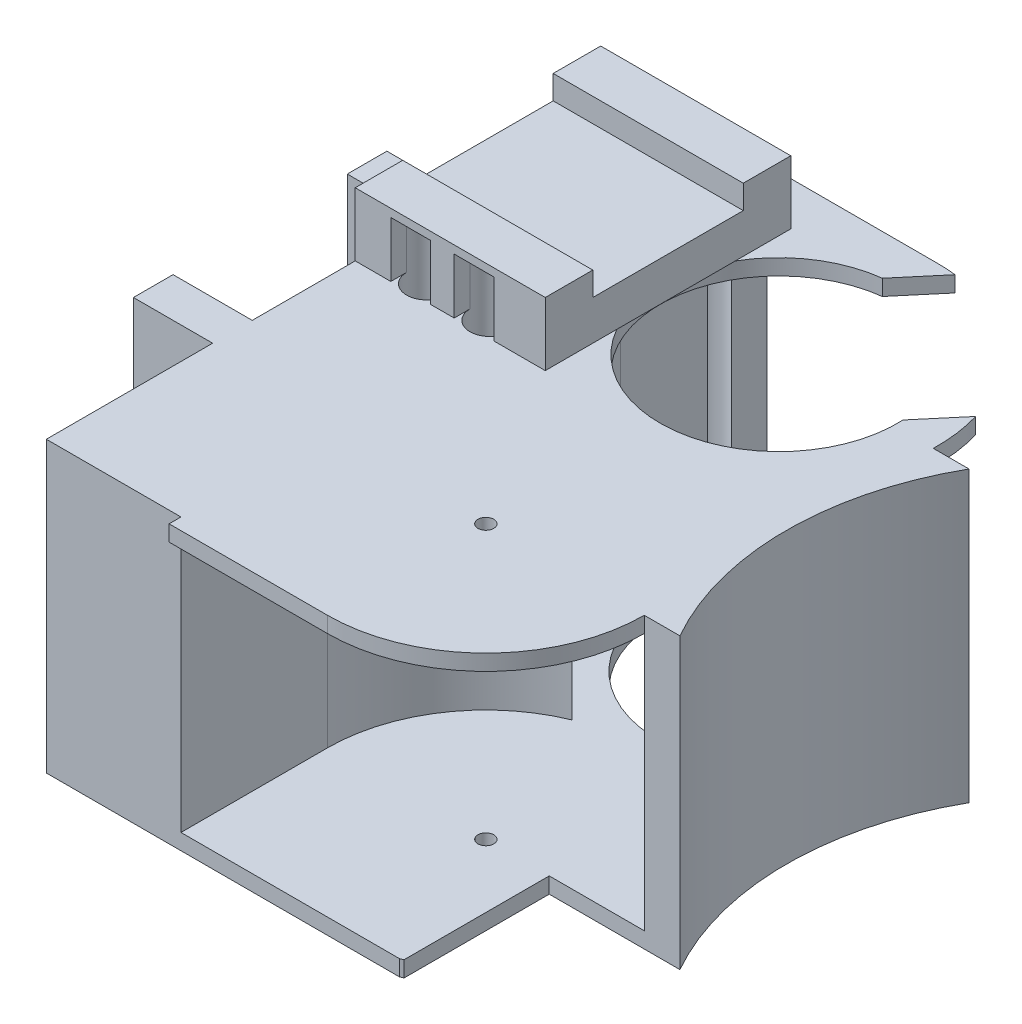
from build123d import *
from build123d.topology import SkipClean

# Parameters (mm, degrees)
SKETCH1_R                = 2.5
SKETCH1_R_2              = 1
SKETCH1_R_3              = 2
BOSS_EXTRUDE18_DEPTH     = 34.5
CUT_EXTRUDE16_START      = -32.5
CUT_EXTRUDE16_DEPTH      = 32.5
BOSS_EXTRUDE21_START     = -2
BOSS_EXTRUDE21_DEPTH     = 2
BOSS_EXTRUDE22_START     = -34.5
SKETCH9_R                = 2
BOSS_EXTRUDE22_DEPTH     = 34.5
BOSS_EXTRUDE23_START     = -34.5
SKETCH10_R               = 2
BOSS_EXTRUDE23_DEPTH     = 34.5
SKETCH11_R               = 2
CUT_EXTRUDE17_DEPTH      = 34.5
SKETCH12_W               = 24
SKETCH12_H               = 27
BOSS_EXTRUDE24_DEPTH     = 8
SKETCH13_W               = 24
SKETCH13_H               = 19
CUT_EXTRUDE18_DEPTH      = 3
SKETCH16_R               = 2.5
CUT_EXTRUDE21_DEPTH      = 41.5
SKETCH20_R               = 2.5
CUT_EXTRUDE22_DEPTH      = 41.5
SKETCH21_R               = 2.5
CUT_EXTRUDE23_DEPTH      = 41.5
SKETCH22_R               = 2.5
CUT_EXTRUDE24_DEPTH      = 41.5
BOSS_EXTRUDE25_DEPTH     = 2
BOSS_EXTRUDE26_DEPTH     = 2
SKETCH27_R               = 1
CUT_EXTRUDE27_DEPTH      = 5
SKETCH28_R               = 1
CUT_EXTRUDE28_DEPTH      = 5
SKETCH29_R               = 15
CUT_EXTRUDE29_DEPTH      = 2
SKETCH30_R               = 1
CUT_EXTRUDE30_DEPTH      = 2
CUT_EXTRUDE31_DEPTH      = 104.309002512
CUT_EXTRUDE31_DEPTH_BACK = 10
BOSS_EXTRUDE28_START     = 2
SKETCH32_R               = 2.5
SKETCH32_R_2             = 1
BOSS_EXTRUDE28_DEPTH     = 2
CUT_EXTRUDE32_DEPTH      = 2
SKETCH35_R               = 15
CUT_EXTRUDE33_DEPTH      = 2
BOSS_EXTRUDE30_START     = -2
SKETCH36_R               = 2.5
BOSS_EXTRUDE30_DEPTH     = 2
CUT_EXTRUDE40_START      = -2
CUT_EXTRUDE40_DEPTH      = 2
SKETCH39_R               = 2.5
CUT_EXTRUDE41_DEPTH      = 2
CUT_EXTRUDE42_START      = -2
CUT_EXTRUDE42_DEPTH      = 2
SKETCH42_R               = 1
BOSS_EXTRUDE31_DEPTH     = 5
SKETCH43_R               = 1
CUT_EXTRUDE44_DEPTH      = 5
SKETCH46_R               = 1
BOSS_EXTRUDE32_DEPTH     = 5
SKETCH47_R               = 1
CUT_EXTRUDE45_DEPTH      = 5
SKETCH48_R               = 1
BOSS_EXTRUDE33_DEPTH     = 5
SKETCH49_R               = 1
CUT_EXTRUDE46_DEPTH      = 5
SKETCH50_R               = 1
BOSS_EXTRUDE34_DEPTH     = 5
SKETCH51_R               = 1
CUT_EXTRUDE47_DEPTH      = 5


with BuildPart() as part:
    # Sketch1 → Boss-Extrude18 (new body)
    with BuildSketch(Plane(origin=(0, 0, 0), x_dir=(1, 0, 0), z_dir=(0, 1, 0))):
        with BuildLine():
            ThreePointArc((44.599342077, 0), (44.800132537, 0.083759004), (45, 0.16969722))
            Line((45, 0.16969722), (45, 18.5))
            Line((45, 18.5), (61.5, 18.5))
            ThreePointArc((61.5, 18.5), (56.685982974, 36.75), (61.5, 55))
            Line((61.5, 55), (51.991664351, 55))
            ThreePointArc((51.991664351, 55), (36.749965261, 40.502084057), (22, 55.5))
            Line((22, 55.5), (22, 74))
            Line((22, 74), (0, 74))
            Line((0, 74), (0, 53))
            Line((0, 53), (-10, 53))
            Line((-10, 53), (-10, 48))
            Line((-10, 48), (0, 48))
            Line((0, 48), (0, 26))
            Line((0, 26), (-10, 26))
            Line((-10, 26), (-10, 21))
            Line((-10, 21), (0, 21))
            Line((0, 21), (0, 0))
            Line((0, 0), (44.599342077, 0))
        make_face()
        with Locations((15, 68)):
            Circle(SKETCH1_R, mode=Mode.SUBTRACT)
        with Locations((37, 18.5)):
            Circle(SKETCH1_R_2, mode=Mode.SUBTRACT)
        with Locations((15, 40)):
            Circle(SKETCH1_R_3, mode=Mode.SUBTRACT)
        with Locations((7, 68)):
            Circle(SKETCH1_R_3, mode=Mode.SUBTRACT)
        with Locations((7, 40)):
            Circle(SKETCH1_R_3, mode=Mode.SUBTRACT)
    extrude(amount=BOSS_EXTRUDE18_DEPTH)

    # Sketch7 → Cut-Extrude16 (cut)
    with BuildSketch(Plane(origin=(0, 34.5, 0), x_dir=(1, 0, 0), z_dir=(0, 1, 0)).offset(CUT_EXTRUDE16_START)):
        with BuildLine():
            Line((17, 55.5), (17, 75.5))
            Line((17, 75.5), (37, 75.5))
            ThreePointArc((37, 75.5), (56.62141687, 59.372983346), (44.599342077, 37))
            ThreePointArc((44.599342077, 37), (56.62141687, 14.627016654), (37, -1.5))
            Line((37, -1.5), (17, -1.5))
            Line((17, -1.5), (17, 18.5))
            ThreePointArc((17, 18.5), (20.386950287, 29.635824138), (29.400657923, 37))
            ThreePointArc((29.400657923, 37), (20.386950287, 44.364175862), (17, 55.5))
        make_face()
    extrude(amount=CUT_EXTRUDE16_DEPTH, mode=Mode.SUBTRACT)

    # Sketch8 → Boss-Extrude21 (add)
    with BuildSketch(Plane(origin=(0, 34.5, 0), x_dir=(1, 0, 0), z_dir=(0, 1, 0)).offset(BOSS_EXTRUDE21_START)):
        with BuildLine():
            Line((17, 18.5), (17, -1.5))
            Line((17, -1.5), (37, -1.5))
            ThreePointArc((37, -1.5), (56.62141687, 14.627016654), (44.599342077, 37))
            ThreePointArc((44.599342077, 37), (56.62141687, 59.372983346), (37, 75.5))
            Line((37, 75.5), (17, 75.5))
            Line((17, 75.5), (17, 55.5))
            ThreePointArc((17, 55.5), (20.386950287, 44.364175862), (29.400657923, 37))
            ThreePointArc((29.400657923, 37), (20.386950287, 29.635824138), (17, 18.5))
        make_face()
    extrude(amount=BOSS_EXTRUDE21_DEPTH)

    # Sketch9 → Boss-Extrude22 (add)
    with BuildSketch(Plane(origin=(0, 34.5, 0), x_dir=(1, 0, 0), z_dir=(0, 1, 0)).offset(BOSS_EXTRUDE22_START)):
        with Locations((7, 40)):
            Circle(SKETCH9_R)
    extrude(amount=BOSS_EXTRUDE22_DEPTH)

    # Sketch10 → Boss-Extrude23 (add)
    with BuildSketch(Plane(origin=(0, 34.5, 0), x_dir=(1, 0, 0), z_dir=(0, 1, 0)).offset(BOSS_EXTRUDE23_START)):
        with Locations((15, 40)):
            Circle(SKETCH10_R)
    extrude(amount=BOSS_EXTRUDE23_DEPTH)

    # Sketch11 → Cut-Extrude17 (cut)
    with BuildSketch(Plane(origin=(0, 34.5, 0), x_dir=(1, 0, 0), z_dir=(0, 1, 0))):
        with Locations((7, 41)):
            Circle(SKETCH11_R)
        with Locations((15, 41)):
            Circle(SKETCH11_R)
    extrude(amount=-CUT_EXTRUDE17_DEPTH, mode=Mode.SUBTRACT)

    # Sketch12 → Boss-Extrude24 (add)
    with BuildSketch(Plane(origin=(0, 34.5, 0), x_dir=(1, 0, 0), z_dir=(0, 1, 0))):
        with Locations((12, 54.5)):
            Rectangle(SKETCH12_W, SKETCH12_H)
    extrude(amount=BOSS_EXTRUDE24_DEPTH)

    # Sketch13 → Cut-Extrude18 (cut)
    with BuildSketch(Plane(origin=(0, 42.5, 0), x_dir=(1, 0, 0), z_dir=(0, 1, 0))):
        with Locations((12, 54.5)):
            Rectangle(SKETCH13_W, SKETCH13_H)
    extrude(amount=-CUT_EXTRUDE18_DEPTH, mode=Mode.SUBTRACT)

    # Sketch16 → Cut-Extrude21 (cut)
    with BuildSketch(Plane(origin=(0, 0, 0), x_dir=(-1, 0, 0), z_dir=(0, -1, 0))):
        with Locations((-7, 68)):
            Circle(SKETCH16_R)
    extrude(amount=-CUT_EXTRUDE21_DEPTH, mode=Mode.SUBTRACT)

    # Sketch20 → Cut-Extrude22 (cut)
    with SkipClean():  # the faces are left unmerged after this step: merging them gives an invalid solid
        with BuildSketch(Plane(origin=(0, 0, 0), x_dir=(-1, 0, 0), z_dir=(0, -1, 0))):
            with Locations((-15, 68)):
                Circle(SKETCH20_R)
        extrude(amount=-CUT_EXTRUDE22_DEPTH, mode=Mode.SUBTRACT)
    add(part.part.scale(1), mode=Mode.REPLACE)  # the faces are merged on a copy

    # Sketch21 → Cut-Extrude23 (cut)
    with BuildSketch(Plane(origin=(0, 0, 0), x_dir=(-1, 0, 0), z_dir=(0, -1, 0))):
        with Locations((-7, 41)):
            Circle(SKETCH21_R)
    extrude(amount=-CUT_EXTRUDE23_DEPTH, mode=Mode.SUBTRACT)

    # Sketch22 → Cut-Extrude24 (cut)
    with BuildSketch(Plane(origin=(0, 0, 0), x_dir=(-1, 0, 0), z_dir=(0, -1, 0))):
        with Locations((-15, 41)):
            Circle(SKETCH22_R)
    extrude(amount=-CUT_EXTRUDE24_DEPTH, mode=Mode.SUBTRACT)

    # Sketch23 → Boss-Extrude25 (add)
    with BuildSketch(Plane(origin=(0, 0, -68), x_dir=(-1, 0, 0), z_dir=(0, 0, -1))):
        Polygon((-24, 39.595178564), (-24, 42.5), (0, 42.5), (0, 34.5), (-4.5, 34.5), (-4.5, 41.5), (-9.5, 41.5), (-9.5, 34.5), (-12.5, 34.5), (-12.5, 41.5), (-17.5, 41.5), (-17.5, 34.5), (-24, 34.5), align=None)
    extrude(amount=BOSS_EXTRUDE25_DEPTH)

    # Sketch26 → Boss-Extrude26 (add)
    with BuildSketch(Plane.XY.offset(-41)):
        Polygon((19.87143218, 42.5), (24, 42.5), (24, 34.5), (17.5, 34.5), (17.5, 41.5), (12.5, 41.5), (12.5, 34.5), (9.5, 34.5), (9.5, 41.5), (4.5, 41.5), (4.5, 34.5), (0, 34.5), (0, 42.5), align=None)
    extrude(amount=BOSS_EXTRUDE26_DEPTH)

    # Sketch27 → Cut-Extrude27 (cut)
    with BuildSketch(Plane(origin=(0, 0, -53), x_dir=(-1, 0, 0), z_dir=(0, 0, -1))):
        with Locations((5, 8.75)):
            Circle(SKETCH27_R)
        with Locations((5, 25.75)):
            Circle(SKETCH27_R)
    extrude(amount=-CUT_EXTRUDE27_DEPTH, mode=Mode.SUBTRACT)

    # Sketch28 → Cut-Extrude28 (cut)
    with BuildSketch(Plane(origin=(0, 0, -26), x_dir=(-1, 0, 0), z_dir=(0, 0, -1))):
        with Locations((5, 8.75)):
            Circle(SKETCH28_R)
        with Locations((5, 25.75)):
            Circle(SKETCH28_R)
    extrude(amount=-CUT_EXTRUDE28_DEPTH, mode=Mode.SUBTRACT)

    # Sketch29 → Cut-Extrude29 (cut)
    with BuildSketch(Plane.XZ.offset(-32.5)):
        with Locations((37, -55.5)):
            Circle(SKETCH29_R)
    extrude(amount=-CUT_EXTRUDE29_DEPTH, mode=Mode.SUBTRACT)

    # Sketch30 → Cut-Extrude30 (cut)
    with BuildSketch(Plane(origin=(0, 32.5, 0), x_dir=(-1, 0, 0), z_dir=(0, -1, 0))):
        with Locations((-37, 18.5)):
            Circle(SKETCH30_R)
    extrude(amount=-CUT_EXTRUDE30_DEPTH, mode=Mode.SUBTRACT)

    # Sketch31 → Cut-Extrude31 (cut, two sides: drawn at the far end of the back side and taken through both)
    with BuildSketch(Plane(origin=(0, 34.5, 0), x_dir=(1, 0, 0), z_dir=(0, 1, 0)).offset(-CUT_EXTRUDE31_DEPTH_BACK)):
        Polygon((180.521185575, 208.383496073), (56.181432658, 61.163271245), (45.403753564, 48.402329534), (28.596246436, 62.597670466), (39.37392553, 75.358612177), (163.713678447, 222.578837004), (412.393184281, 517.019286659), (429.200691409, 502.823945727), align=None)
    extrude(amount=CUT_EXTRUDE31_DEPTH + CUT_EXTRUDE31_DEPTH_BACK, mode=Mode.SUBTRACT)

    # Sketch32 → Boss-Extrude28 (add)
    with SkipClean():  # the faces are left unmerged after this step: merging them gives an invalid solid
        with BuildSketch(Plane(origin=(0, 0, 0), x_dir=(-1, 0, 0), z_dir=(0, -1, 0)).offset(BOSS_EXTRUDE28_START)):
            Polygon((0, 74), (0, 53), (10, 53), (10, 48), (0, 48), (0, 26), (10, 26), (10, 21), (0, 21), (0, 0), (-44.599342077, 0), (-45, 0.16969722), (-45, 18.5), (-61.5, 18.5), (-61.5, 55), (-51.991664351, 55), (-22, 55.5), (-22, 74), align=None)
            with Locations((-7, 68)):
                Circle(SKETCH32_R, mode=Mode.SUBTRACT)
            with Locations((-7, 41)):
                Circle(SKETCH32_R, mode=Mode.SUBTRACT)
            with Locations((-15, 68)):
                Circle(SKETCH32_R, mode=Mode.SUBTRACT)
            with Locations((-15, 41)):
                Circle(SKETCH32_R, mode=Mode.SUBTRACT)
            with Locations((-37, 18.5)):
                Circle(SKETCH32_R_2, mode=Mode.SUBTRACT)
        extrude(amount=-BOSS_EXTRUDE28_DEPTH)

    # Sketch34 → Cut-Extrude32 (cut)
    with SkipClean():  # the faces are left unmerged after this step: merging them gives an invalid solid
        with BuildSketch(Plane(origin=(0, -2, 0), x_dir=(-1, 0, 0), z_dir=(0, -1, 0))):
            with BuildLine():
                Line((-61.5, 55), (-61.5, 18.5))
                ThreePointArc((-61.5, 18.5), (-56.685982974, 36.75), (-61.5, 55))
            make_face()
        extrude(amount=-CUT_EXTRUDE32_DEPTH, mode=Mode.SUBTRACT)

    # Sketch35 → Cut-Extrude33 (cut)
    with SkipClean():  # the faces are left unmerged after this step: merging them gives an invalid solid
        with BuildSketch(Plane(origin=(0, -2, 0), x_dir=(-1, 0, 0), z_dir=(0, -1, 0))):
            with Locations((-36.996772278, 55.249984327)):
                Circle(SKETCH35_R)
        extrude(amount=-CUT_EXTRUDE33_DEPTH, mode=Mode.SUBTRACT)

    # Sketch36 → Boss-Extrude30 (add)
    with SkipClean():  # the faces are left unmerged after this step: merging them gives an invalid solid
        with BuildSketch(Plane(origin=(0, -2, 0), x_dir=(-1, 0, 0), z_dir=(0, -1, 0)).offset(BOSS_EXTRUDE30_START)):
            with Locations((-15, 68)):
                Circle(SKETCH36_R)
        extrude(amount=-BOSS_EXTRUDE30_DEPTH)

    # Sketch38 → Cut-Extrude40 (cut)
    with BuildSketch(Plane.XZ.offset(2).offset(CUT_EXTRUDE40_START)):
        with BuildLine():
            Line((17, -75.5), (57, -75.5))
            Line((57, -75.5), (57, -55.5))
            ThreePointArc((57, -55.5), (37, -35.5), (17, -55.5))
            Line((17, -55.5), (17, -75.5))
        make_face()
    extrude(amount=-CUT_EXTRUDE40_DEPTH, mode=Mode.SUBTRACT)

    # Sketch39 → Cut-Extrude41 (cut)
    with SkipClean():  # the faces are left unmerged after this step: merging them gives an invalid solid
        with BuildSketch(Plane(origin=(0, 0, 0), x_dir=(-1, 0, 0), z_dir=(0, -1, 0))):
            with Locations((-15, 68)):
                Circle(SKETCH39_R)
        extrude(amount=-CUT_EXTRUDE41_DEPTH, mode=Mode.SUBTRACT)

    # Sketch41 → Cut-Extrude42 (cut)
    with BuildSketch(Plane(origin=(0, -2, 0), x_dir=(-1, 0, 0), z_dir=(0, -1, 0)).offset(CUT_EXTRUDE42_START)):
        with BuildLine():
            Line((-17, 18.5), (-17, -1.5))
            Line((-17, -1.5), (-37, -1.5))
            Line((-37, -1.5), (-57, -1.5))
            Line((-57, -1.5), (-57, 18.5))
            ThreePointArc((-57, 18.5), (-37, 38.5), (-17, 18.5))
        make_face()
    extrude(amount=-CUT_EXTRUDE42_DEPTH, mode=Mode.SUBTRACT)

    # Sketch42 → Boss-Extrude31 (add)
    with BuildSketch(Plane(origin=(0, 0, -26), x_dir=(-1, 0, 0), z_dir=(0, 0, -1))):
        with Locations((5, 8.75)):
            Circle(SKETCH42_R)
    extrude(amount=-BOSS_EXTRUDE31_DEPTH)

    # Sketch43 → Cut-Extrude44 (cut)
    with BuildSketch(Plane(origin=(0, 0, -26), x_dir=(-1, 0, 0), z_dir=(0, 0, -1))):
        with Locations((5, 8.25)):
            Circle(SKETCH43_R)
    extrude(amount=-CUT_EXTRUDE44_DEPTH, mode=Mode.SUBTRACT)

    # Sketch46 → Boss-Extrude32 (add)
    with BuildSketch(Plane(origin=(0, 0, -26), x_dir=(-1, 0, 0), z_dir=(0, 0, -1))):
        with Locations((5, 25.75)):
            Circle(SKETCH46_R)
    extrude(amount=-BOSS_EXTRUDE32_DEPTH)

    # Sketch47 → Cut-Extrude45 (cut)
    with BuildSketch(Plane(origin=(0, 0, -26), x_dir=(-1, 0, 0), z_dir=(0, 0, -1))):
        with Locations((5, 24.25)):
            Circle(SKETCH47_R)
    extrude(amount=-CUT_EXTRUDE45_DEPTH, mode=Mode.SUBTRACT)

    # Sketch48 → Boss-Extrude33 (add)
    with BuildSketch(Plane(origin=(0, 0, -53), x_dir=(-1, 0, 0), z_dir=(0, 0, -1))):
        with Locations((5, 8.75)):
            Circle(SKETCH48_R)
    extrude(amount=-BOSS_EXTRUDE33_DEPTH)

    # Sketch49 → Cut-Extrude46 (cut)
    with BuildSketch(Plane(origin=(0, 0, -53), x_dir=(-1, 0, 0), z_dir=(0, 0, -1))):
        with Locations((5, 8.25)):
            Circle(SKETCH49_R)
    extrude(amount=-CUT_EXTRUDE46_DEPTH, mode=Mode.SUBTRACT)

    # Sketch50 → Boss-Extrude34 (add)
    with BuildSketch(Plane(origin=(0, 0, -53), x_dir=(-1, 0, 0), z_dir=(0, 0, -1))):
        with Locations((5, 25.75)):
            Circle(SKETCH50_R)
    extrude(amount=-BOSS_EXTRUDE34_DEPTH)

    # Sketch51 → Cut-Extrude47 (cut)
    with BuildSketch(Plane(origin=(0, 0, -53), x_dir=(-1, 0, 0), z_dir=(0, 0, -1))):
        with Locations((5, 24.25)):
            Circle(SKETCH51_R)
    extrude(amount=-CUT_EXTRUDE47_DEPTH, mode=Mode.SUBTRACT)


solid = part.part
